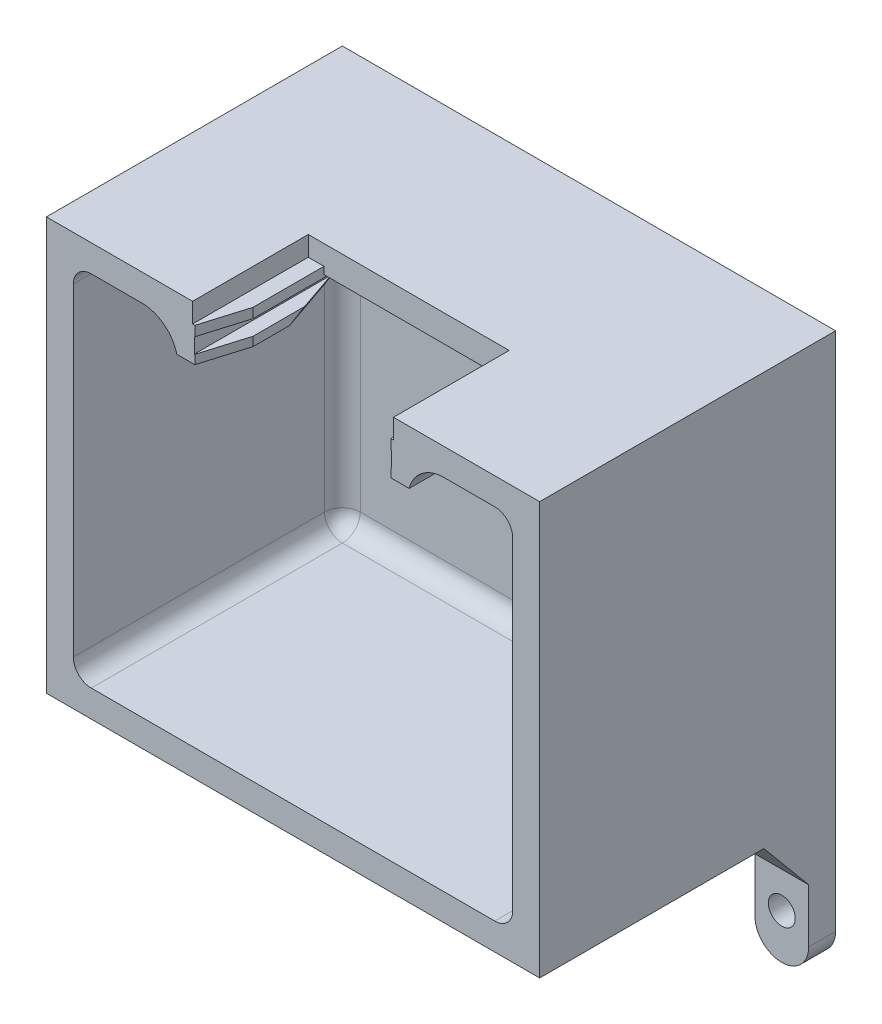
from build123d import *
from OCP.BRepFilletAPI import BRepFilletAPI_MakeChamfer

# Parameters (mm, degrees)
SKETCH_1_R           = 1.5
SKETCH_1_W           = 16.5
SKETCH_1_H           = 10
EXTRUDE_1_DEPTH      = 3
SKETCH_2_W           = 55
SKETCH_2_H           = 46
SKETCH_2_W_2         = 49
SKETCH_2_H_2         = 40
EXTRUDE_2_DEPTH      = 30
SKETCH_3_W           = 22.4
SKETCH_3_H           = 13.1
CUT_EXTRUDE_1_DEPTH  = 40
EXTRUDE_3_DEPTH      = 12.9
EXTRUDE_3_DEPTH_BACK = 2
FILLET_1_R           = 4
CHAMFER_1_SIZE       = 1.5
CHAMFER_1_SIZE2      = 5
CHAMFER_2_SIZE       = 5
CHAMFER_2_SIZE2      = 1.5
CHAMFER_3_SIZE       = 5
CHAMFER_3_SIZE_2     = 3
CHAMFER_6_SIZE       = 6
CHAMFER_6_SIZE2      = 5
FILLET_2_R           = 3
FILLET_3_R           = 2


# Some blends are built 0.0001 mm under size
with BuildPart() as part:
    # Эскиз1 → Бобышка-Вытянуть1 (new body)
    with BuildSketch(Plane.XY):
        Polygon((27.5, 43), (-27.5, 43), (-27.5, -3), (-27.5, -18), (-21.5, -18), (-21.5, -3), (21.5, -3), (21.5, -18), (27.5, -18), (27.5, -3), align=None)
        with Locations((-24.5, -13)):
            Circle(SKETCH_1_R, mode=Mode.SUBTRACT)
        with Locations((24.5, -13)):
            Circle(SKETCH_1_R, mode=Mode.SUBTRACT)
        with Locations((0, 35)):
            Rectangle(SKETCH_1_W, SKETCH_1_H, mode=Mode.SUBTRACT)
    extrude(amount=EXTRUDE_1_DEPTH)

    # Эскиз2 → Бобышка-Вытянуть2 (add)
    with BuildSketch(Plane.XY.offset(3)):
        with Locations((0, 20)):
            Rectangle(SKETCH_2_W, SKETCH_2_H)
        with Locations((0, 20)):
            Rectangle(SKETCH_2_W_2, SKETCH_2_H_2, mode=Mode.SUBTRACT)
    extrude(amount=EXTRUDE_2_DEPTH)

    # Эскиз3 → Вырез-Вытянуть1 (cut)
    with BuildSketch(Plane(origin=(0, 43, 0), x_dir=(1, 0, 0), z_dir=(0, 1, 0))):
        with Locations((0, -26.65)):
            Rectangle(SKETCH_3_W, SKETCH_3_H)
    extrude(amount=-CUT_EXTRUDE_1_DEPTH, mode=Mode.SUBTRACT)

    # Эскиз4 → Бобышка-Вытянуть3 (add, two sides: drawn at the far end of the back side and taken through both)
    with BuildSketch(Plane.XY.offset(20.1).offset(-EXTRUDE_3_DEPTH_BACK)):
        Polygon((11.2, 40), (11.2, 40.8), (11, 40.8), (9.45, 40.8), (9.45, 40), align=None)
        Polygon((11.2, 40), (9.45, 40), (9.45, 39.7), (11, 39.7), (11, 38), (9.45, 38), (9.45, 37), (12.95, 37), (12.95, 40), align=None)
        Polygon((-11.2, 40), (-9.45, 40), (-9.45, 40.8), (-11, 40.8), (-11.2, 40.8), align=None)
        Polygon((-9.45, 39.7), (-9.45, 40), (-11.2, 40), (-12.95, 40), (-12.95, 37), (-9.45, 37), (-9.45, 38), (-11, 38), (-11, 39.7), align=None)
    extrude(amount=EXTRUDE_3_DEPTH + EXTRUDE_3_DEPTH_BACK)

    # Скругление1
    # the kernel refuses this fillet: 4 mm, written as the material it adds along each edge
    with BuildSketch(Plane(origin=(-12.95, 40, 18.1), x_dir=(-1, 0, 0), z_dir=(0, 0, 1))) as fillet_1_piece_1:
        with BuildLine():
            CenterArc((3.872983346, 4), FILLET_1_R, 194.477512186, 75.522487814)
            Line((0, 3), (-0.077459667, 2.98))
            ThreePointArc((-0.077459667, 2.98), (-0.08, 1.5), (-0.08, 0))
            Line((-0.08, 0), (0, -0.08))
            Line((0, -0.08), (3.872983346, -0.08))
            Line((3.872983346, -0.08), (3.872983346, 0))
        make_face()
    extrude(amount=14.9)
    with BuildSketch(Plane(origin=(12.95, 40, 33), x_dir=(0, -1, 0), z_dir=(0, 0, -1))) as fillet_1_piece_2:
        with BuildLine():
            CenterArc((4, -3.872983346), FILLET_1_R, 104.477512186, 75.522487814)
            Line((0, -3.872983346), (-0.08, -3.872983346))
            Line((-0.08, -3.872983346), (-0.08, 0))
            Line((-0.08, 0), (0, 0.08))
            ThreePointArc((0, 0.08), (1.5, 0.08), (2.98, 0.077459667))
            Line((2.98, 0.077459667), (3, 0))
        make_face()
    extrude(amount=14.9)

    # Фаска1
    chamfer_1_edges = [part.edges().sort_by_distance(p)[0] for p in [
        (9.45, 37.5, 33),
        (-9.45, 40.25, 33),
        (-9.45, 37.5, 33),
    ]]
    chamfer_1_side = [part.faces().sort_by_distance(p)[0] for p in [
        (13.93441787, 39.729121995, 33),
    ]]
    chamfer(chamfer_1_edges, length=CHAMFER_1_SIZE, length2=CHAMFER_1_SIZE2, reference=chamfer_1_side[0])

    # Фаска2
    chamfer_2_edges = [part.edges().sort_by_distance(p)[0] for p in [
        (9.45, 40.25, 33),
    ]]
    chamfer_2_side = [part.faces().sort_by_distance(p)[0] for p in [
        (9.45, 40.233772819, 26.247768763),
    ]]
    chamfer(chamfer_2_edges, length=CHAMFER_2_SIZE, length2=CHAMFER_2_SIZE2, reference=chamfer_2_side[0])

    # Фаска3
    chamfer_3_edges_1 = [part.edges().sort_by_distance(p)[0] for p in [
        (13.136491673, 40, 18.1),
    ]]
    chamfer_3_side_1 = [part.faces().sort_by_distance(p)[0] for p in [
        (13.136491673, 40, 18.04),
    ]]
    chamfer_3_edges_2 = [part.edges().sort_by_distance(p)[0] for p in [
        (-13.136491673, 40, 18.1),
    ]]
    chamfer_3_side_2 = [part.faces().sort_by_distance(p)[0] for p in [
        (-13.136491673, 40, 18.04),
    ]]
    chamfer_3 = BRepFilletAPI_MakeChamfer(part.part.solid().wrapped)
    for e in chamfer_3_edges_1:
        chamfer_3.Add(CHAMFER_3_SIZE - 0.0001, CHAMFER_3_SIZE_2 - 0.0001, e.wrapped, chamfer_3_side_1[0].wrapped)
    for e in chamfer_3_edges_2:
        chamfer_3.Add(CHAMFER_3_SIZE - 0.0001, CHAMFER_3_SIZE_2 - 0.0001, e.wrapped, chamfer_3_side_2[0].wrapped)
    add(Compound.cast(chamfer_3.Shape()), mode=Mode.REPLACE)  # a hair under: the kernel refuses the full size

    # Фаска5
    # the kernel refuses this chamfer: 3, 2 mm, written as the material it takes off along each edge
    with BuildSketch(Plane(origin=(9.45, 41.988024108, 9.786682308), x_dir=(0, 0.8574959522145404, 0.514490711223904), z_dir=(0, -0.514490711223904, 0.8574959522145406))) as chamfer_5_piece_1_section:
        with BuildLine():
            Line((3.099846035, 0.066564024), (-0.099846035, -2.066564024))
            Line((-0.099846035, -2.066564024), (-0.159846035, -2.066564024))
            ThreePointArc((-0.159846035, -2.066564024), (-0.06, -1.033282012), (-0.06, 0))
            Line((-0.06, 0), (0, 0.06))
            ThreePointArc((0, 0.06), (1.549923018, 0.06), (3.099846035, 0.126564024))
            Line((3.099846035, 0.126564024), (3.099846035, 0.066564024))
        make_face()
    chamfer_5_piece_1 = extrude(amount=17.446278464, mode=Mode.PRIVATE)
    chamfer_5_piece_1 = split(chamfer_5_piece_1, bisect_by=Plane(origin=(9.45, 40, 9.786682308), z_dir=(0, -1, 0)), keep=Keep.TOP, mode=Mode.PRIVATE)
    add(chamfer_5_piece_1, mode=Mode.SUBTRACT)
    with BuildSketch(Plane(origin=(-9.45, 41.988024108, 9.786682308), x_dir=(-1, 0, 0), z_dir=(0, -0.514490711223904, 0.8574959522145406))) as chamfer_5_piece_2_section:
        with BuildLine():
            Line((2.066564024, 0.099846035), (-0.066564024, -3.099846035))
            Line((-0.066564024, -3.099846035), (-0.126564024, -3.099846035))
            ThreePointArc((-0.126564024, -3.099846035), (-0.06, -1.549923018), (-0.06, 0))
            Line((-0.06, 0), (0, 0.06))
            ThreePointArc((0, 0.06), (1.033282012, 0.06), (2.066564024, 0.159846035))
            Line((2.066564024, 0.159846035), (2.066564024, 0.099846035))
        make_face()
    chamfer_5_piece_2 = extrude(amount=17.446278464, mode=Mode.PRIVATE)
    chamfer_5_piece_2 = split(chamfer_5_piece_2, bisect_by=Plane(origin=(-9.45, 40, 9.786682308), z_dir=(0, -1, 0)), keep=Keep.TOP, mode=Mode.PRIVATE)
    add(chamfer_5_piece_2, mode=Mode.SUBTRACT)

    # Фаска6: one chamfer whose edges measure the first distance from different faces: ONE call of the kernel's chamfer builder (chamfer() names one face for all edges)
    chamfer_6_edges_1 = [part.edges().sort_by_distance(p)[0] for p in [
        (24.5, -3, 3),
    ]]
    chamfer_6_side_1 = [part.faces().sort_by_distance(p)[0] for p in [
        (24.5, -10.286914786, 3),
    ]]
    chamfer_6_edges_2 = [part.edges().sort_by_distance(p)[0] for p in [
        (-24.5, -3, 3),
    ]]
    chamfer_6_side_2 = [part.faces().sort_by_distance(p)[0] for p in [
        (-24.5, -10.286914786, 3),
    ]]
    chamfer_6 = BRepFilletAPI_MakeChamfer(part.part.solid().wrapped)
    for e in chamfer_6_edges_1:
        chamfer_6.Add(CHAMFER_6_SIZE, CHAMFER_6_SIZE2, e.wrapped, chamfer_6_side_1[0].wrapped)  # the first distance lies on this face
    for e in chamfer_6_edges_2:
        chamfer_6.Add(CHAMFER_6_SIZE, CHAMFER_6_SIZE2, e.wrapped, chamfer_6_side_2[0].wrapped)  # the first distance lies on this face
    add(Compound.cast(chamfer_6.Shape()), mode=Mode.REPLACE)

    # Скругление2
    fillet_2_edges = [part.edges().sort_by_distance(p)[0] for p in [
        (27.5, -18, 1.5),
        (21.5, -18, 1.5),
        (-21.5, -18, 1.5),
        (-27.5, -18, 1.5),
    ]]
    fillet(fillet_2_edges, radius=FILLET_2_R - 0.0001)  # a hair under: the kernel refuses the full size

    # Скругление3
    fillet_3_edges = [part.edges().sort_by_distance(p)[0] for p in [
        (-16.375, 40, 3),
        (16.375, 40, 3),
        (-24.5, 20, 3),
        (0, 0, 3),
        (24.5, 20, 3),
        (-24.5, 0, 18),
        (24.5, 0, 18),
        (24.5, 40, 18),
        (-24.5, 40, 18),
    ]]
    fillet(fillet_3_edges, radius=FILLET_3_R)


solid = part.part
